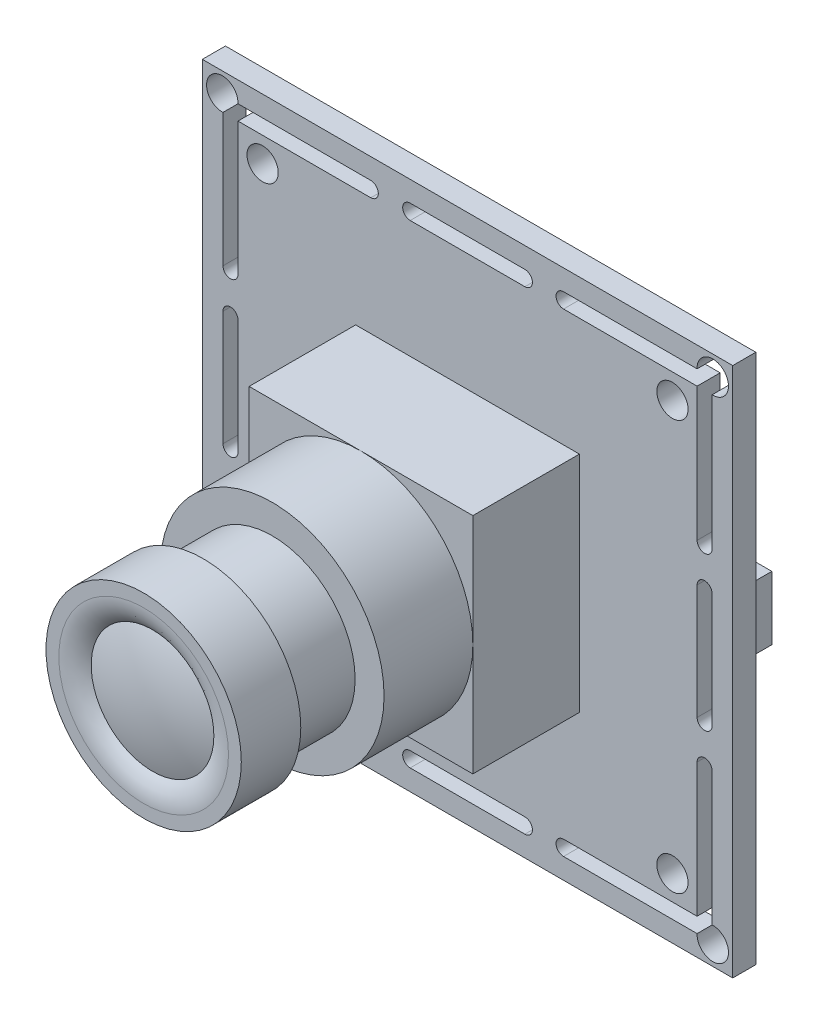
from build123d import *

# Parameters (mm, degrees)
SKETCH1_W           = 37.9349
SKETCH1_H           = 37.9349
BOSS_EXTRUDE1_DEPTH = 1.651
SKETCH2_W           = 16.002
SKETCH2_H           = 16.002
BOSS_EXTRUDE2_DEPTH = 7.62
SKETCH3_R           = 8.001
BOSS_EXTRUDE3_DEPTH = 6.35
SKETCH4_R           = 5.9309
BOSS_EXTRUDE4_DEPTH = 4.9403
SKETCH5_R           = 6.985
BOSS_EXTRUDE5_DEPTH = 4.2545
SKETCH6_R           = 4.38785
CUT_EXTRUDE1_DEPTH  = 0.635
FILLET2_R           = 2.54
SKETCH9_R           = 1.1176
CUT_EXTRUDE2_DEPTH  = 1.651
SKETCH12_W          = 3.3274
SKETCH12_H          = 4.5466
BOSS_EXTRUDE6_DEPTH = 3.6957
SKETCH13_W          = 10.16
SKETCH13_H          = 4.7117
BOSS_EXTRUDE7_DEPTH = 5.6515
SKETCH14_W          = 4.8006
SKETCH14_H          = 6.0833
BOSS_EXTRUDE8_DEPTH = 5.842
SKETCH15_W          = 3.3528
SKETCH15_H          = 4.5212
BOSS_EXTRUDE9_DEPTH = 4.6101


# Read off the part's stored shape, not the designer's step: Dome1
with BuildPart() as part:
    # Sketch1 → Boss-Extrude1 (new body)
    with BuildSketch(Plane.XY):
        with Locations((18.96745, 18.96745)):
            Rectangle(SKETCH1_W, SKETCH1_H)
    extrude(amount=BOSS_EXTRUDE1_DEPTH)

    # Sketch2 → Boss-Extrude2 (add)
    with BuildSketch(Plane.XY.offset(1.651)):
        with Locations((18.96745, 18.96745)):
            Rectangle(SKETCH2_W, SKETCH2_H)
    extrude(amount=BOSS_EXTRUDE2_DEPTH)

    # Sketch3 → Boss-Extrude3 (add)
    with BuildSketch(Plane.XY.offset(9.271)):
        with Locations((18.96745, 18.96745)):
            Circle(SKETCH3_R)
    extrude(amount=BOSS_EXTRUDE3_DEPTH)

    # Sketch4 → Boss-Extrude4 (add)
    with BuildSketch(Plane.XY.offset(15.621)):
        with Locations((18.96745, 18.96745)):
            Circle(SKETCH4_R)
    extrude(amount=BOSS_EXTRUDE4_DEPTH)

    # Sketch5 → Boss-Extrude5 (add)
    with BuildSketch(Plane.XY.offset(20.5613)):
        with Locations((18.96745, 18.96745)):
            Circle(SKETCH5_R)
    extrude(amount=BOSS_EXTRUDE5_DEPTH)

    # Sketch6 → Cut-Extrude1 (cut)
    with BuildSketch(Plane.XY.offset(24.8158)):
        with Locations((18.96745, 18.96745)):
            Circle(SKETCH6_R)
    extrude(amount=-CUT_EXTRUDE1_DEPTH, mode=Mode.SUBTRACT)

    # Fillet2
    # the kernel refuses this fillet: 2.54 mm, written as the material it takes off along each edge
    with BuildSketch(Plane(origin=(18.96745, 18.96745, 24.8158), x_dir=(1, 0, 0), z_dir=(0, -1, 0))) as fillet2_piece_1:
        with BuildLine():
            CenterArc((6.067902083, -2.54), FILLET2_R, 90, 41.409622109)
            Line((4.38785, -0.635), (4.354248958, -0.5969))
            ThreePointArc((4.354248958, -0.5969), (4.33705, -0.3175), (4.33705, 0))
            Line((4.33705, 0), (4.38785, 0.0508))
            Line((4.38785, 0.0508), (6.067902083, 0.0508))
            Line((6.067902083, 0.0508), (6.067902083, 0))
        make_face()
    revolve(axis=Axis((18.96745, 18.96745, 24.8158), (0, 0, 1)), mode=Mode.SUBTRACT)

    # Dome1 outline → Dome1 (revolve)
    with BuildSketch(Plane(origin=(18.96745, 18.96745, 0), x_dir=(1, 0, 0), z_dir=(0, -1, 0))):
        with BuildLine():
            Line((0, 24.1808), (4.387850012, 24.180799996))
            ThreePointArc((4.387850012, 24.180799996), (2.22676176, 24.75088497), (0, 24.9428))
            Line((0, 24.9428), (0, 24.1808))
        make_face()
    revolve(axis=Axis((18.96745, 18.96745, 0), (0, 0, 1)))

    # Sketch9 → Cut-Extrude2 (cut)
    with BuildSketch(Plane.XY.offset(1.651)):
        with Locations((33.62325, 33.62325)):
            Circle(SKETCH9_R)
        with Locations((4.31165, 33.62325)):
            Circle(SKETCH9_R)
        with Locations((4.31165, 4.31165)):
            Circle(SKETCH9_R)
        with Locations((33.62325, 4.31165)):
            Circle(SKETCH9_R)
        with BuildLine():
            Line((35.385619933, 12.100169933), (35.385619933, 2.549280067))
            Line((35.385619933, 2.549280067), (25.834730067, 2.549280067))
            ThreePointArc((25.834730067, 2.549280067), (25.2984, 2.01295), (25.834730067, 1.476619933))
            Line((25.834730067, 1.476619933), (35.385619933, 1.476619933))
            ThreePointArc((35.385619933, 1.476619933), (37.303202335, 0.631697665), (36.458280067, 2.549280067))
            Line((36.458280067, 2.549280067), (36.458280067, 12.100169933))
            ThreePointArc((36.458280067, 12.100169933), (35.92195, 12.6365), (35.385619933, 12.100169933))
        make_face()
        with BuildLine():
            Line((35.385619933, 36.458280067), (25.834730067, 36.458280067))
            ThreePointArc((25.834730067, 36.458280067), (25.2984, 35.92195), (25.834730067, 35.385619933))
            Line((25.834730067, 35.385619933), (35.385619933, 35.385619933))
            Line((35.385619933, 35.385619933), (35.385619933, 25.834730067))
            ThreePointArc((35.385619933, 25.834730067), (35.92195, 25.2984), (36.458280067, 25.834730067))
            Line((36.458280067, 25.834730067), (36.458280067, 35.385619933))
            ThreePointArc((36.458280067, 35.385619933), (37.303202335, 37.303202335), (35.385619933, 36.458280067))
        make_face()
        with BuildLine():
            Line((12.048880067, 36.458280067), (2.549280067, 36.458280067))
            ThreePointArc((2.549280067, 36.458280067), (0.631697665, 37.303202335), (1.476619933, 35.385619933))
            Line((1.476619933, 35.385619933), (1.476619933, 25.886019933))
            ThreePointArc((1.476619933, 25.886019933), (2.01295, 25.349689867), (2.549280067, 25.886019933))
            Line((2.549280067, 25.886019933), (2.549280067, 35.385619933))
            Line((2.549280067, 35.385619933), (12.048880067, 35.385619933))
            ThreePointArc((12.048880067, 35.385619933), (12.585210133, 35.92195), (12.048880067, 36.458280067))
        make_face()
        with BuildLine():
            Line((23.06955, 36.458280067), (14.86535, 36.458280067))
            ThreePointArc((14.86535, 36.458280067), (14.329019933, 35.92195), (14.86535, 35.385619933))
            Line((14.86535, 35.385619933), (23.06955, 35.385619933))
            ThreePointArc((23.06955, 35.385619933), (23.605880067, 35.92195), (23.06955, 36.458280067))
        make_face()
        with BuildLine():
            Line((2.549280067, 23.06955), (2.549280067, 14.86535))
            ThreePointArc((2.549280067, 14.86535), (2.01295, 14.329019933), (1.476619933, 14.86535))
            Line((1.476619933, 14.86535), (1.476619933, 23.06955))
            ThreePointArc((1.476619933, 23.06955), (2.01295, 23.605880067), (2.549280067, 23.06955))
        make_face()
        with BuildLine():
            Line((36.458280067, 23.06955), (36.458280067, 14.86535))
            ThreePointArc((36.458280067, 14.86535), (35.92195, 14.329019933), (35.385619933, 14.86535))
            Line((35.385619933, 14.86535), (35.385619933, 23.06955))
            ThreePointArc((35.385619933, 23.06955), (35.92195, 23.605880067), (36.458280067, 23.06955))
        make_face()
        with BuildLine():
            Line((23.06955, 2.549280067), (14.86535, 2.549280067))
            ThreePointArc((14.86535, 2.549280067), (14.329019933, 2.01295), (14.86535, 1.476619933))
            Line((14.86535, 1.476619933), (23.06955, 1.476619933))
            ThreePointArc((23.06955, 1.476619933), (23.605880067, 2.01295), (23.06955, 2.549280067))
        make_face()
        with BuildLine():
            Line((2.549280067, 12.100169933), (2.549280067, 2.549280067))
            Line((2.549280067, 2.549280067), (12.100169933, 2.549280067))
            ThreePointArc((12.100169933, 2.549280067), (12.6365, 2.01295), (12.100169933, 1.476619933))
            Line((12.100169933, 1.476619933), (2.600569933, 1.476619933))
            ThreePointArc((2.600569933, 1.476619933), (0.681867267, 0.681867267), (1.476619933, 2.600569933))
            Line((1.476619933, 2.600569933), (1.476619933, 12.100169933))
            ThreePointArc((1.476619933, 12.100169933), (2.01295, 12.6365), (2.549280067, 12.100169933))
        make_face()
    extrude(amount=-CUT_EXTRUDE2_DEPTH, mode=Mode.SUBTRACT)

    # Sketch12 → Boss-Extrude6 (add)
    with BuildSketch(Plane(origin=(0, 0, 0), x_dir=(-1, 0, 0), z_dir=(0, 0, -1))):
        with Locations((-33.721919933, 18.96745)):
            Rectangle(SKETCH12_W, SKETCH12_H)
    extrude(amount=BOSS_EXTRUDE6_DEPTH)

    # Sketch13 → Boss-Extrude7 (add)
    with BuildSketch(Plane(origin=(0, 0, 0), x_dir=(-1, 0, 0), z_dir=(0, 0, -1))):
        with Locations((-23.8125, 4.905130067)):
            Rectangle(SKETCH13_W, SKETCH13_H)
    extrude(amount=BOSS_EXTRUDE7_DEPTH)

    # Sketch14 → Boss-Extrude8 (add)
    with BuildSketch(Plane(origin=(0, 0, 0), x_dir=(-1, 0, 0), z_dir=(0, 0, -1))):
        with Locations((-4.949580067, 12.02055)):
            Rectangle(SKETCH14_W, SKETCH14_H)
    extrude(amount=BOSS_EXTRUDE8_DEPTH)

    # Sketch15 → Boss-Extrude9 (add)
    with BuildSketch(Plane(origin=(0, 0, 0), x_dir=(-1, 0, 0), z_dir=(0, 0, -1))):
        with Locations((-4.225680067, 17.3228)):
            Rectangle(SKETCH15_W, SKETCH15_H)
    extrude(amount=BOSS_EXTRUDE9_DEPTH)


solid = part.part
